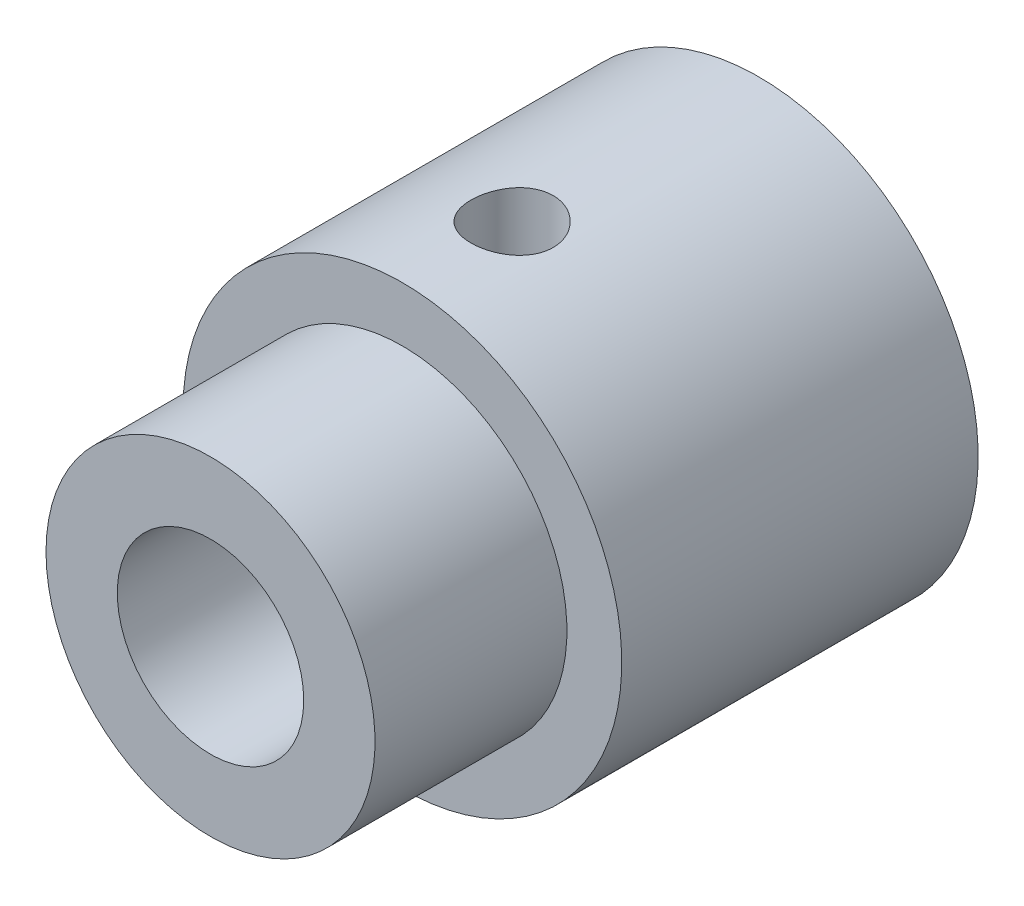
from build123d import *

# Parameters (mm, degrees)
CUT_EXTRUDE1_REACH               = 24.978
SKETCH2_R                        = 1.5
CUT_EXTRUDE1_DIRECTION_2_REACH   = 24.978
TAP_DRILL_FOR_M8X1_25_TAP2_D     = 6.8
TAP_DRILL_FOR_M8X1_25_TAP2_DEPTH = 10
TAP_DRILL_FOR_M8X1_25_TAP2_TIP   = 2.042926105


with BuildPart() as part:
    # Sketch1 → Revolve1 (revolve)
    with BuildSketch(Plane(origin=(0, 0, 0), x_dir=(0, 0, -1), z_dir=(1, 0, 0))):
        Polygon((0, 0), (0, 6), (7, 6), (7, 8), (20, 8), (20, 3.2), (9.5, 3.2), (7.577246019, 0), align=None)
    revolve(axis=Axis((0, 0, -7.577246019), (0, 0, 1)))

    # Sketch2 → Cut-Extrude1 (cut, up to next)
    with BuildSketch(Plane(origin=(0, 0, 0), x_dir=(1, 0, 0), z_dir=(0, 1, 0)), mode=Mode.PRIVATE) as cut_extrude1_sk1:
        with Locations((0, 11)):
            Circle(SKETCH2_R)
    cut_extrude1_tool1 = extrude(cut_extrude1_sk1.sketch, amount=-CUT_EXTRUDE1_REACH, mode=Mode.PRIVATE) & part.part
    add(cut_extrude1_tool1.solids().sort_by_distance((0, 0, -11))[0], mode=Mode.SUBTRACT)

    # Sketch2 → Cut-Extrude1 direction 2 (cut, up to next)
    with BuildSketch(Plane(origin=(0, 0, 0), x_dir=(1, 0, 0), z_dir=(0, 1, 0)), mode=Mode.PRIVATE) as cut_extrude1_direction_2_sk1:
        with Locations((0, 11)):
            Circle(SKETCH2_R)
    cut_extrude1_direction_2_tool1 = extrude(cut_extrude1_direction_2_sk1.sketch, amount=CUT_EXTRUDE1_DIRECTION_2_REACH, mode=Mode.PRIVATE) & part.part
    add(cut_extrude1_direction_2_tool1.solids().sort_by_distance((0, 0, -11))[0], mode=Mode.SUBTRACT)

    # Tap Drill for M8x1.25 Tap2
    with Locations(Plane.XY):
        with Locations((0, 0)):
            Hole(TAP_DRILL_FOR_M8X1_25_TAP2_D / 2, depth=TAP_DRILL_FOR_M8X1_25_TAP2_DEPTH)
            with Locations((0, 0, -(TAP_DRILL_FOR_M8X1_25_TAP2_DEPTH + TAP_DRILL_FOR_M8X1_25_TAP2_TIP / 2))):  # 118° drill point
                Cone(0, TAP_DRILL_FOR_M8X1_25_TAP2_D / 2, TAP_DRILL_FOR_M8X1_25_TAP2_TIP, mode=Mode.SUBTRACT)


solid = part.part
